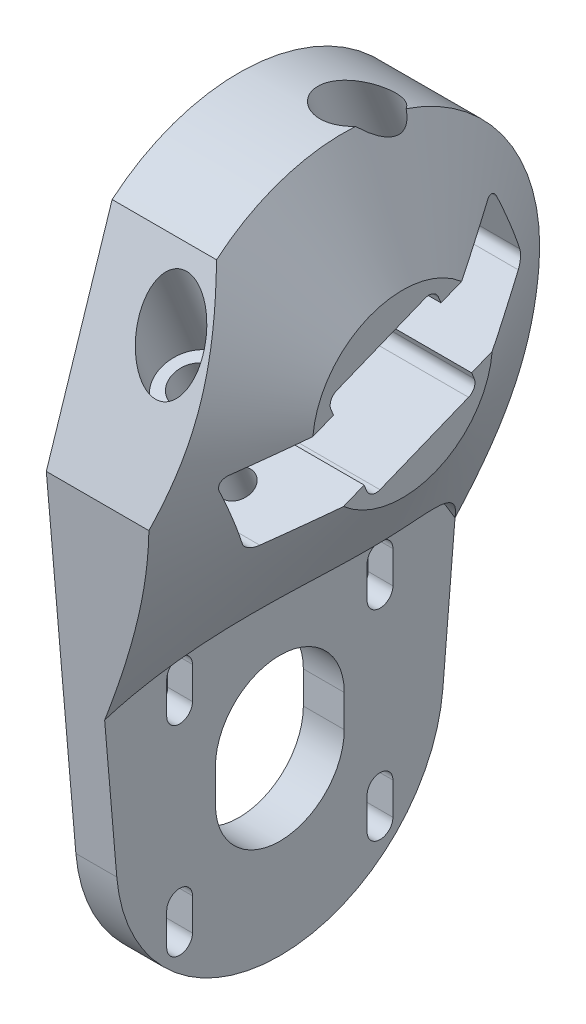
from build123d import *

# Parameters (mm, degrees)
BOSS_EXTRUDE1_DEPTH = 6.35
CUT_EXTRUDE18_DEPTH = 10
SKETCH20_R          = 57.15
BOSS_EXTRUDE5_DEPTH = 19.05
CUT_EXTRUDE14_DEPTH = 106.568863781
SKETCH22_R          = 3.175
CUT_EXTRUDE15_DEPTH = 112.617572861
SKETCH24_R          = 5
CUT_EXTRUDE16_DEPTH = 117.479633609
SKETCH25_R          = 2.38125
CUT_EXTRUDE17_DEPTH = 10
CHAMFER2_SIZE       = 2.5
FILLET1_R           = 1.5875
SKETCH28_R          = 31
CUT_EXTRUDE19_DEPTH = 105.22344993
CUT_EXTRUDE20_DEPTH = 100.584343315
CUT_EXTRUDE21_DEPTH = 94.849309593


with BuildPart() as part:
    # Sketch1 → Boss-Extrude1 (new body)
    with BuildSketch(Plane(origin=(0, 0, 0), x_dir=(0, 0, -1), z_dir=(1, 0, 0))):
        with BuildLine():
            ThreePointArc((30.369265969, -2.595782062), (0, 30.48), (-30.369265969, -2.595782062))
            Line((-30.369265969, -2.595782062), (-25.307721641, -61.813151718))
            ThreePointArc((-25.307721641, -61.813151718), (0, -85.05), (25.307721641, -61.813151718))
            Line((25.307721641, -61.813151718), (30.369265969, -2.595782062))
        make_face()
        Polygon((-11.716114032, 4.97319535), (4.97319535, 11.716114032), (11.716114032, -4.97319535), (-4.97319535, -11.716114032), align=None, mode=Mode.SUBTRACT)
    extrude(amount=BOSS_EXTRUDE1_DEPTH)

    # Sketch19 → Cut-Extrude18 (cut)
    with BuildSketch(Plane(origin=(6.35, 0, 0), x_dir=(0, 0, -1), z_dir=(1, 0, 0))):
        with BuildLine():
            Line((13.556349186, -39.093650814), (13.556349186, -44.093650814))
            ThreePointArc((13.556349186, -44.093650814), (15.556349186, -46.093650814), (17.556349186, -44.093650814))
            Line((17.556349186, -44.093650814), (17.556349186, -39.093650814))
            ThreePointArc((17.556349186, -39.093650814), (15.556349186, -37.093650814), (13.556349186, -39.093650814))
        make_face()
        with BuildLine():
            Line((-10, -54.65), (-10, -59.65))
            ThreePointArc((-10, -59.65), (0, -69.65), (10, -59.65))
            Line((10, -59.65), (10, -54.65))
            ThreePointArc((10, -54.65), (0, -44.65), (-10, -54.65))
        make_face()
        with BuildLine():
            Line((17.556349186, -75.206349186), (17.556349186, -70.206349186))
            ThreePointArc((17.556349186, -70.206349186), (15.556349186, -68.206349186), (13.556349186, -70.206349186))
            Line((13.556349186, -70.206349186), (13.556349186, -75.206349186))
            ThreePointArc((13.556349186, -75.206349186), (15.556349186, -77.206349186), (17.556349186, -75.206349186))
        make_face()
        with BuildLine():
            Line((-17.556349186, -39.093650814), (-17.556349186, -44.093650814))
            ThreePointArc((-17.556349186, -44.093650814), (-15.556349186, -46.093650814), (-13.556349186, -44.093650814))
            Line((-13.556349186, -44.093650814), (-13.556349186, -39.093650814))
            ThreePointArc((-13.556349186, -39.093650814), (-15.556349186, -37.093650814), (-17.556349186, -39.093650814))
        make_face()
        with BuildLine():
            Line((-13.556349186, -75.206349186), (-13.556349186, -70.206349186))
            ThreePointArc((-13.556349186, -70.206349186), (-15.556349186, -68.206349186), (-17.556349186, -70.206349186))
            Line((-17.556349186, -70.206349186), (-17.556349186, -75.206349186))
            ThreePointArc((-17.556349186, -75.206349186), (-15.556349186, -77.206349186), (-13.556349186, -75.206349186))
        make_face()
    extrude(amount=-CUT_EXTRUDE18_DEPTH, mode=Mode.SUBTRACT)

    # Sketch20 → Boss-Extrude5 (add)
    with BuildSketch(Plane(origin=(6.35, 0, 0), x_dir=(0, 0, -1), z_dir=(1, 0, 0))):
        Circle(SKETCH20_R)
    extrude(amount=BOSS_EXTRUDE5_DEPTH)

    # Sketch21 → Cut-Extrude14 (cut, through all)
    with BuildSketch(Plane.ZY):
        Polygon((-19.873660641, 14.878175718), (-24.631164378, 3.102940765), (-10.723406559, -2.516158136), (-11.716114032, -4.97319535), (4.97319535, -11.716114032), (5.965902823, -9.259076817), (18.961748401, -14.509739258), (23.719252138, -2.734504305), (10.723406559, 2.516158136), (11.716114032, 4.97319535), (-4.97319535, 11.716114032), (-5.965902823, 9.259076817), align=None)
    extrude(amount=-CUT_EXTRUDE14_DEPTH, mode=Mode.SUBTRACT)

    # Sketch22 → Cut-Extrude15 (cut, through all)
    with BuildSketch(Plane(origin=(0, 5.887617476, 2.378751868), x_dir=(-1, 0, 0), z_dir=(0, -0.9271838545667868, -0.37460659341591374))):
        with Locations((-12.5, -16.5)):
            Circle(SKETCH22_R)
    cut_extrude15 = extrude(amount=-CUT_EXTRUDE15_DEPTH, mode=Mode.SUBTRACT)

    # Sketch24 → Cut-Extrude16 (cut, through all)
    with BuildSketch(Plane(origin=(0, 10.597711458, 4.281753363), x_dir=(-1, 0, 0), z_dir=(0, -0.9271838545667868, -0.37460659341591374))):
        with Locations((-12.5, -16.5)):
            Circle(SKETCH24_R)
    cut_extrude16 = extrude(amount=-CUT_EXTRUDE16_DEPTH, mode=Mode.SUBTRACT)

    # Sketch25 → Cut-Extrude17 (cut)
    with BuildSketch(Plane(origin=(0, -5.887617476, -2.378751868), x_dir=(1, 0, 0), z_dir=(0, 0.927183854566787, 0.3746065934159135))):
        with Locations((12.5, -16.5)):
            Circle(SKETCH25_R)
    cut_extrude17 = extrude(amount=-CUT_EXTRUDE17_DEPTH, mode=Mode.SUBTRACT)

    # Mirror1: Cut-Extrude15, Cut-Extrude16, Cut-Extrude17 across plane
    add(cut_extrude15.mirror(Plane(origin=(0, 0, 0), x_dir=(1, 0, 0), z_dir=(0, 0.3746065934159135, -0.927183854566787))), mode=Mode.SUBTRACT)
    add(cut_extrude16.mirror(Plane(origin=(0, 0, 0), x_dir=(1, 0, 0), z_dir=(0, 0.3746065934159135, -0.927183854566787))), mode=Mode.SUBTRACT)
    add(cut_extrude17.mirror(Plane(origin=(0, 0, 0), x_dir=(1, 0, 0), z_dir=(0, 0.3746065934159135, -0.927183854566787))), mode=Mode.SUBTRACT)


with BuildPart() as body_2:
    # Mirror2: mirrored copy
    add(part.part.mirror(Plane(origin=(0, 0, 0), x_dir=(0, 0, 1), z_dir=(1, 0, 0))))


with BuildPart() as part_1:
    add(part.part)

    # Chamfer2
    chamfer2_edges = [part_1.edges().sort_by_distance(p)[0] for p in [
        (0, -46.093650814, 15.556349186),
        (0, -41.593650814, 13.556349186),
        (0, -37.093650814, 15.556349186),
        (0, -41.593650814, 17.556349186),
        (0, -46.093650814, -15.556349186),
        (0, -41.593650814, -17.556349186),
        (0, -41.593650814, -13.556349186),
        (0, -37.093650814, -15.556349186),
    ]]
    chamfer(chamfer2_edges, length=CHAMFER2_SIZE)

    # Fillet1
    fillet1_edges = [part_1.edges().sort_by_distance(p)[0] for p in [
        (12.7, -4.97319535, -11.716114032),
        (12.7, 3.102940765, -24.631164378),
        (12.7, 11.716114032, -4.97319535),
        (12.7, 14.878175718, -19.873660641),
        (12.7, -2.734504305, 23.719252138),
        (12.7, 4.97319535, 11.716114032),
        (12.7, -11.716114032, 4.97319535),
        (12.7, -14.509739258, 18.961748401),
    ]]
    fillet(fillet1_edges, radius=FILLET1_R)

    # Sketch28 → Cut-Extrude19 (cut, through all)
    with BuildSketch(Plane(origin=(6.35, 0, 0), x_dir=(0, 0, -1), z_dir=(1, 0, 0))):
        with Locations((0, -54.65)):
            Circle(SKETCH28_R)
    extrude(amount=CUT_EXTRUDE19_DEPTH, mode=Mode.SUBTRACT)

    # Sketch31 → Cut-Revolve1 (revolve, cut)
    with BuildSketch(Plane(origin=(0, 0, 0), x_dir=(1, 0, 0), z_dir=(0, 1, 0))):
        Polygon((25.4, -59.952108656), (25.4, -13.97), (6.35, -48.172984338), (6.35, -59.952108656), align=None)
    revolve(axis=Axis((25.4, 0, 0), (-1, 0, 0)), mode=Mode.SUBTRACT)

    # Sketch32 → Cut-Extrude20 (cut, through all)
    with BuildSketch(Plane.ZY.offset(-6.35)):
        with BuildLine():
            ThreePointArc((-30.369265969, -2.595782062), (0, 30.48), (30.369265969, -2.595782062))
            Line((30.369265969, -2.595782062), (27.192308406, -39.764491491))
            ThreePointArc((27.192308406, -39.764491491), (42.606167787, -22.480010821), (48.172984338, 0))
            ThreePointArc((48.172984338, 0), (-22.480010821, 42.606167787), (-27.192308406, -39.764491491))
            Line((-27.192308406, -39.764491491), (-30.369265969, -2.595782062))
        make_face()
    extrude(amount=-CUT_EXTRUDE20_DEPTH, mode=Mode.SUBTRACT)

    # Sketch33 → Cut-Extrude21 (cut, through all)
    with BuildSketch(Plane.ZY):
        with BuildLine():
            Line((29.893453073, -8.16253923), (30.369265969, -2.595782062))
            ThreePointArc((30.369265969, -2.595782062), (28.169721121, 11.64032697), (19.678291434, 23.276495575))
            Line((19.678291434, 23.276495575), (29.893453073, -8.16253923))
        make_face()
    extrude(amount=-CUT_EXTRUDE21_DEPTH, mode=Mode.SUBTRACT)


solid = part_1.part
